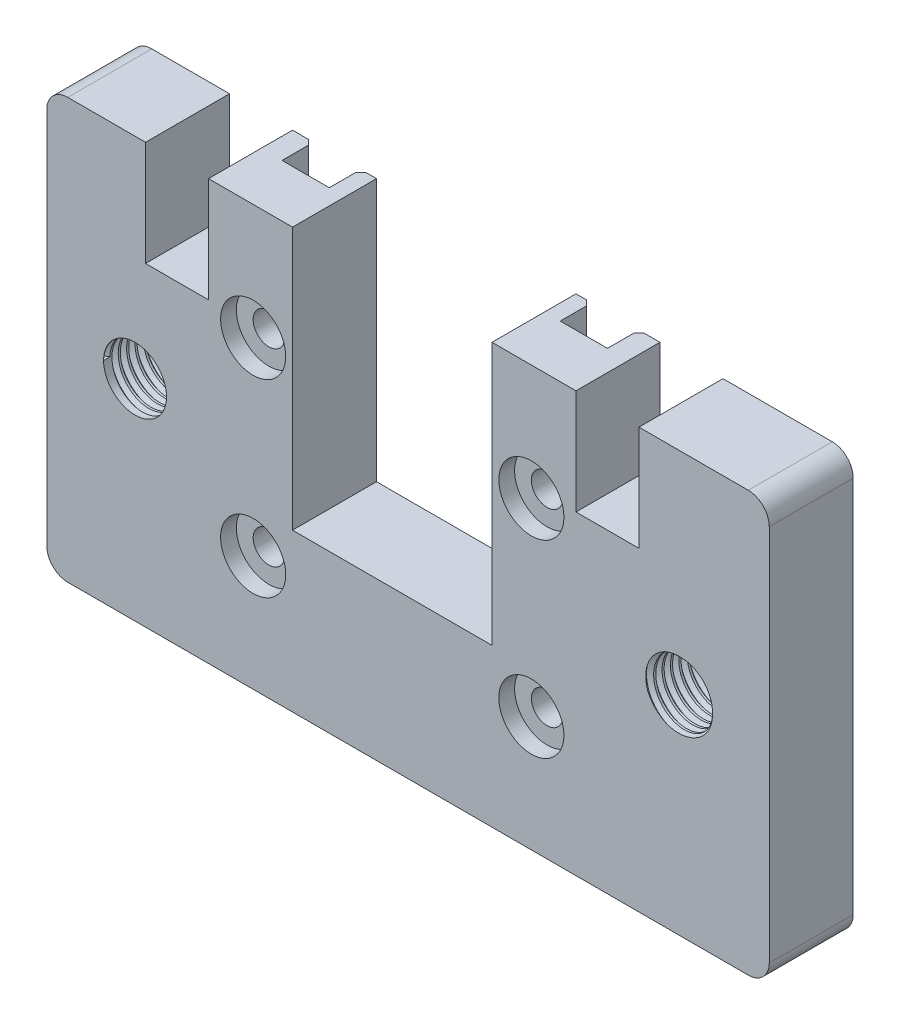
from build123d import *
from build123d.topology import SkipClean

# Parameters (mm, degrees)
SKETCH_1_R          = 3
EXTRUDE_1_DEPTH     = 8
CUT_EXTRUDE_START   = -8
SKETCH_2_W          = 4.5
SKETCH_2_H          = 40
CUT_EXTRUDE_1_DEPTH = 3
CHAMFER_1_SIZE      = 0.5
SKETCH_3_R          = 1.5
CUT_EXTRUDE_2_DEPTH = 10
FILLET_1_R          = 2
SKETCH_5_R          = 3.1
CUT_EXTRUDE_3_DEPTH = 1.5
SKETCH_6_W          = 19
SKETCH_6_H          = 25
CUT_EXTRUDE_4_DEPTH = 10
SKETCH_7_W          = 6
SKETCH_7_H          = 10
CUT_EXTRUDE_5_DEPTH = 10
THREAD_1_PITCH      = 0.8
THREAD_2_PITCH      = 0.8


with BuildPart() as part:
    # Sketch 1 → 凸台-拉伸1 (new body)
    with BuildSketch(Plane.XY):
        Polygon((-22.266880757, 20), (22.266880757, 20), (34.409301068, 20), (34.409301068, -20), (22.266880757, -20), (-22.266880757, -20), (-34.409301068, -20), (-34.409301068, 20), align=None)
        with Locations((-26, 0)):
            Circle(SKETCH_1_R, mode=Mode.SUBTRACT)
        with Locations((26, 0)):
            Circle(SKETCH_1_R, mode=Mode.SUBTRACT)
    extrude(amount=-EXTRUDE_1_DEPTH)

    # Sketch 2 → 切除-拉伸1 (cut)
    with BuildSketch(Plane.XY.offset(CUT_EXTRUDE_START)):
        with Locations((-14.75, 0)):
            Rectangle(SKETCH_2_W, SKETCH_2_H)
        with Locations((11.75, 0)):
            Rectangle(SKETCH_2_W, SKETCH_2_H)
    extrude(amount=CUT_EXTRUDE_1_DEPTH, mode=Mode.SUBTRACT)

    # 倒角1
    chamfer_1_edges = [part.edges().sort_by_distance(p)[0] for p in [
        (-17, 0, -8),
        (-12.5, 0, -8),
        (9.5, 0, -8),
        (14, 0, -8),
    ]]
    chamfer(chamfer_1_edges, length=CHAMFER_1_SIZE)

    # 草图3 → 切除-拉伸2 (cut)
    with BuildSketch(Plane(origin=(0, 0, -5), x_dir=(-1, 0, 0), z_dir=(0, 0, -1))):
        with Locations((-11.75, 9)):
            Circle(SKETCH_3_R)
        with Locations((14.75, 9)):
            Circle(SKETCH_3_R)
        with Locations((-11.75, -9)):
            Circle(SKETCH_3_R)
        with Locations((14.75, -9)):
            Circle(SKETCH_3_R)
    extrude(amount=-CUT_EXTRUDE_2_DEPTH, mode=Mode.SUBTRACT)

    # 圆角1
    fillet_1_edges = [part.edges().sort_by_distance(p)[0] for p in [
        (-34.409301068, 20, -4),
        (34.409301068, 20, -4),
        (34.409301068, -20, -4),
        (-34.409301068, -20, -4),
    ]]
    fillet(fillet_1_edges, radius=FILLET_1_R)

    # 草图5 → 切除-拉伸3 (cut)
    with BuildSketch(Plane.XY):
        with Locations((-14.75, 9)):
            Circle(SKETCH_5_R)
        with Locations((11.75, 9)):
            Circle(SKETCH_5_R)
        with Locations((11.75, -9)):
            Circle(SKETCH_5_R)
        with Locations((-14.75, -9)):
            Circle(SKETCH_5_R)
    extrude(amount=-CUT_EXTRUDE_3_DEPTH, mode=Mode.SUBTRACT)

    # 草图6 → 切除-拉伸4 (cut)
    with BuildSketch(Plane(origin=(0, 0, -8), x_dir=(-1, 0, 0), z_dir=(0, 0, -1))):
        with Locations((1.5, 7.5)):
            Rectangle(SKETCH_6_W, SKETCH_6_H)
    extrude(amount=-CUT_EXTRUDE_4_DEPTH, mode=Mode.SUBTRACT)

    # 草图7 → 切除-拉伸5 (cut)
    with BuildSketch(Plane(origin=(0, 0, -8), x_dir=(-1, 0, 0), z_dir=(0, 0, -1))):
        with Locations((-19, 15)):
            Rectangle(SKETCH_7_W, SKETCH_7_H)
        with Locations((22, 15)):
            Rectangle(SKETCH_7_W, SKETCH_7_H)
    extrude(amount=-CUT_EXTRUDE_5_DEPTH, mode=Mode.SUBTRACT)

    # 螺纹线1: the profile of Sketch 1 2 profile screwed along a right-hand helix of 10 turns, 8 arcs to a turn; built about Z, then put on its axis
    with SkipClean():  # the faces are left unmerged after this step: merging them gives an invalid solid
        thread_1_z = Axis((0, 0, 0), (0, 0, 1))
        thread_1_corners = [(2.9997, 0, -0.000173205), (3.4330127, 0, 0.249999999), (3.4330127, 0, 0.349999999), (2.9997, 0, 0.600173203)]
        with BuildLine(mode=Mode.PRIVATE) as thread_1_profile:
            Line(thread_1_corners[0], thread_1_corners[1])
            Line(thread_1_corners[1], thread_1_corners[2])
            Line(thread_1_corners[2], thread_1_corners[3])
            Line(thread_1_corners[3], thread_1_corners[0])
        thread_1_cap = Face(thread_1_profile.wire())
        thread_1_turn_angles = [0, 22.5, 45, 67.5, 90, 112.5, 135, 157.5, 180, 202.5, 225, 247.5, 270, 292.5, 315, 337.5, 360]
        thread_1_turn_weights = [1, 0.9238795325112867, 1, 0.9238795325112867, 1, 0.9238795325112867, 1, 0.9238795325112867, 1, 0.9238795325112867, 1, 0.9238795325112867, 1, 0.9238795325112867, 1, 0.9238795325112867, 1]
        thread_1_turn_rails = [Edge.make_bspline([Vector(p[0], p[1], 0).rotate(thread_1_z, thread_1_turn_angles[k]) / thread_1_turn_weights[k] + Vector(0, 0, p[2] + THREAD_1_PITCH * thread_1_turn_angles[k] / 360) for k in range(17)], [0, 0, 0, 1, 1, 2, 2, 3, 3, 4, 4, 5, 5, 6, 6, 7, 7, 8, 8, 8], 2, thread_1_turn_weights) for p in thread_1_corners]
        thread_1_turn_sides = [Face.make_surface_from_curves(thread_1_turn_rails[p[0]], thread_1_turn_rails[p[1]]) for p in [(0, 1), (1, 2), (2, 3), (3, 0)]]
        thread_1 = Plane(origin=(-26, 0, 0), x_dir=(-1, 0, 0), z_dir=(0, 0, -1)) * Solid(Shell([*[p.moved(Location((0, 0, THREAD_1_PITCH * i))) for i in range(10) for p in thread_1_turn_sides], thread_1_cap, thread_1_cap.rotate(thread_1_z, 3600).moved(Location((0, 0, THREAD_1_PITCH * 3600 / 360)))]))
        add(thread_1, mode=Mode.SUBTRACT)

    # 螺纹线2: the profile of Sketch 2 2 profile screwed along a right-hand helix of 10 turns, 8 arcs to a turn; built about Z, then put on its axis
    with SkipClean():  # the faces are left unmerged after this step: merging them gives an invalid solid
        thread_2_z = Axis((0, 0, 0), (0, 0, 1))
        thread_2_corners = [(2.9997, 0, -0.000173205), (3.4330127, 0, 0.249999999), (3.4330127, 0, 0.349999999), (2.9997, 0, 0.600173203)]
        with BuildLine(mode=Mode.PRIVATE) as thread_2_profile:
            Line(thread_2_corners[0], thread_2_corners[1])
            Line(thread_2_corners[1], thread_2_corners[2])
            Line(thread_2_corners[2], thread_2_corners[3])
            Line(thread_2_corners[3], thread_2_corners[0])
        thread_2_cap = Face(thread_2_profile.wire())
        thread_2_turn_angles = [0, 22.5, 45, 67.5, 90, 112.5, 135, 157.5, 180, 202.5, 225, 247.5, 270, 292.5, 315, 337.5, 360]
        thread_2_turn_weights = [1, 0.9238795325112867, 1, 0.9238795325112867, 1, 0.9238795325112867, 1, 0.9238795325112867, 1, 0.9238795325112867, 1, 0.9238795325112867, 1, 0.9238795325112867, 1, 0.9238795325112867, 1]
        thread_2_turn_rails = [Edge.make_bspline([Vector(p[0], p[1], 0).rotate(thread_2_z, thread_2_turn_angles[k]) / thread_2_turn_weights[k] + Vector(0, 0, p[2] + THREAD_2_PITCH * thread_2_turn_angles[k] / 360) for k in range(17)], [0, 0, 0, 1, 1, 2, 2, 3, 3, 4, 4, 5, 5, 6, 6, 7, 7, 8, 8, 8], 2, thread_2_turn_weights) for p in thread_2_corners]
        thread_2_turn_sides = [Face.make_surface_from_curves(thread_2_turn_rails[p[0]], thread_2_turn_rails[p[1]]) for p in [(0, 1), (1, 2), (2, 3), (3, 0)]]
        thread_2 = Plane(origin=(26, 0, -8), x_dir=(1, 0, 0), z_dir=(0, 0, 1)) * Solid(Shell([*[p.moved(Location((0, 0, THREAD_2_PITCH * i))) for i in range(10) for p in thread_2_turn_sides], thread_2_cap, thread_2_cap.rotate(thread_2_z, 3600).moved(Location((0, 0, THREAD_2_PITCH * 3600 / 360)))]))
        add(thread_2, mode=Mode.SUBTRACT)


solid = part.part
